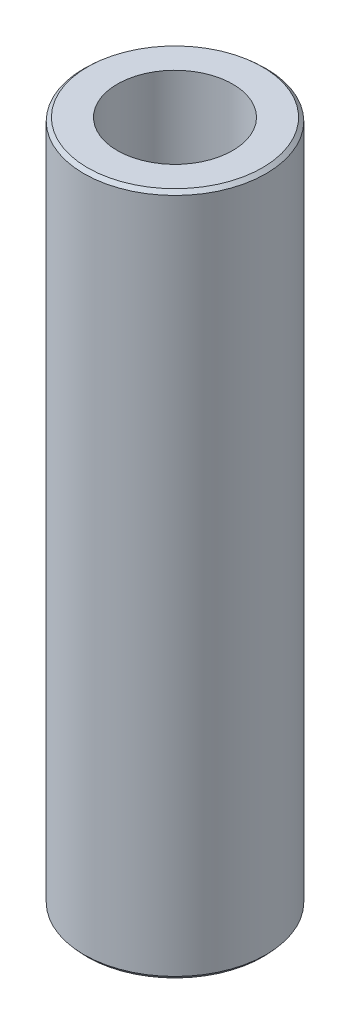
from build123d import *
from OCP.BRepFilletAPI import BRepFilletAPI_MakeChamfer

# Parameters (mm, degrees)
SKETCH1_R           = 35
BOSS_EXTRUDE1_DEPTH = 262.587591258
SKETCH2_R           = 22.157066456
CUT_EXTRUDE1_DEPTH  = 268.211981548
CHAMFER1_SIZE       = 1.265423882
CHAMFER1_SIZE2      = 1.403656228


with BuildPart() as part:
    # Sketch1 → Boss-Extrude1 (new body)
    with BuildSketch(Plane(origin=(0, 0, 0), x_dir=(1, 0, 0), z_dir=(0, 1, 0))):
        Circle(SKETCH1_R)
    extrude(amount=BOSS_EXTRUDE1_DEPTH)

    # Sketch2 → Cut-Extrude1 (cut, through all)
    with BuildSketch(Plane(origin=(0, 0, 0), x_dir=(1, 0, 0), z_dir=(0, 1, 0))):
        Circle(SKETCH2_R)
    extrude(amount=CUT_EXTRUDE1_DEPTH, mode=Mode.SUBTRACT)

    # Chamfer1: one chamfer whose edges measure the first distance from different faces: ONE call of the kernel's chamfer builder (chamfer() names one face for all edges)
    chamfer1_edges_1 = [part.edges().sort_by_distance(p)[0] for p in [
        (-35, 262.587591258, 0),
    ]]
    chamfer1_side_1 = [part.faces().sort_by_distance(p)[0] for p in [
        (-35, 131.293795629, 0),
    ]]
    chamfer1_edges_2 = [part.edges().sort_by_distance(p)[0] for p in [
        (-35, 0, 0),
    ]]
    chamfer1_side_2 = [part.faces().sort_by_distance(p)[0] for p in [
        (-34.010050506, 0, 0),
    ]]
    chamfer1 = BRepFilletAPI_MakeChamfer(part.part.solid().wrapped)
    for e in chamfer1_edges_1:
        chamfer1.Add(CHAMFER1_SIZE, CHAMFER1_SIZE2, e.wrapped, chamfer1_side_1[0].wrapped)  # the first distance lies on this face
    for e in chamfer1_edges_2:
        chamfer1.Add(CHAMFER1_SIZE, CHAMFER1_SIZE2, e.wrapped, chamfer1_side_2[0].wrapped)  # the first distance lies on this face
    add(Compound.cast(chamfer1.Shape()), mode=Mode.REPLACE)


solid = part.part
